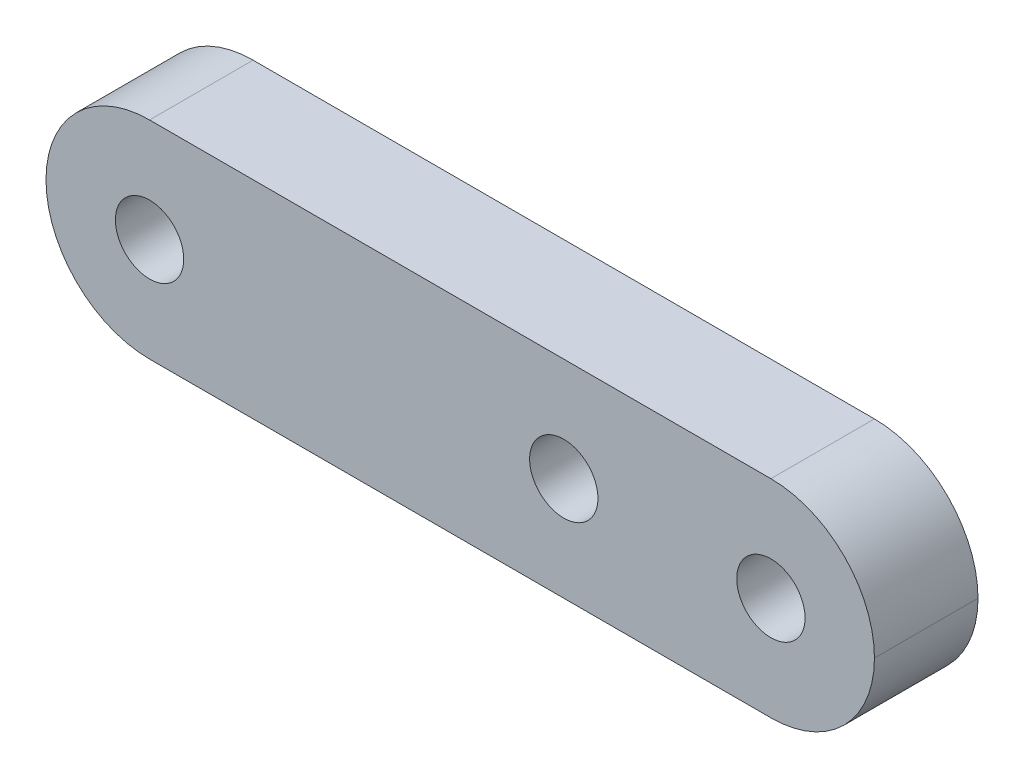
from build123d import *

# Parameters (mm, degrees)
SKICA1_W                 = 40
SKICA1_H                 = 10
P_IDAT_VYSUNUT_M1_DEPTH  = 5
SKICA2_R                 = 1.65
ODEBRAT_VYSUNUT_M1_DEPTH = 5
ZAOBLIT2_R               = 5
SKICA3_R                 = 1.65
ODEBRAT_VYSUNUT_M2_DEPTH = 10


with BuildPart() as part:
    # Skica1 → Přidat vysunutím1 (new body)
    with BuildSketch(Plane.XY):
        with Locations((20, 5)):
            Rectangle(SKICA1_W, SKICA1_H)
    extrude(amount=P_IDAT_VYSUNUT_M1_DEPTH)

    # Skica2 → Odebrat vysunutím1 (cut)
    with BuildSketch(Plane.XY.offset(5)):
        with Locations((5, 5)):
            Circle(SKICA2_R)
        with Locations((35, 5)):
            Circle(SKICA2_R)
    extrude(amount=-ODEBRAT_VYSUNUT_M1_DEPTH, mode=Mode.SUBTRACT)

    # Zaoblit2
    zaoblit2_edges = [part.edges().sort_by_distance(p)[0] for p in [
        (40, 0, 2.5),
        (40, 10, 2.5),
        (0, 0, 2.5),
        (0, 10, 2.5),
    ]]
    fillet(zaoblit2_edges, radius=ZAOBLIT2_R - 0.0001)  # a hair under: the kernel refuses the full size

    # Skica3 → Odebrat vysunutím2 (cut)
    with BuildSketch(Plane.XY.offset(5)):
        with Locations((25, 5)):
            Circle(SKICA3_R)
    extrude(amount=-ODEBRAT_VYSUNUT_M2_DEPTH, mode=Mode.SUBTRACT)


solid = part.part
